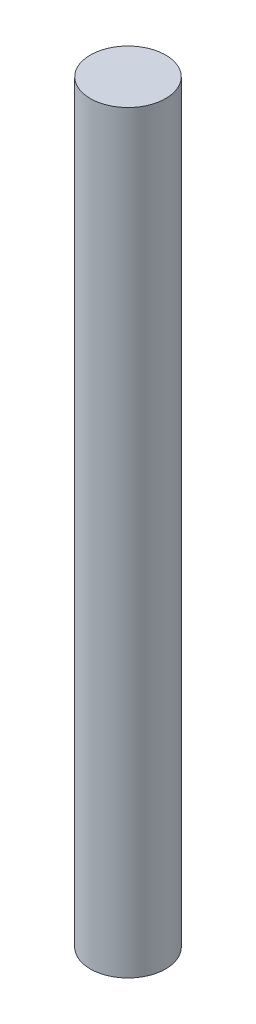
from build123d import *

# Parameters (mm, degrees)
SKETCH1_R           = 4.7625
BOSS_EXTRUDE1_DEPTH = 95.25


with BuildPart() as part:
    # Sketch1 → Boss-Extrude1 (new body)
    with BuildSketch(Plane(origin=(0, 0, 0), x_dir=(1, 0, 0), z_dir=(0, 1, 0))):
        Circle(SKETCH1_R)
    extrude(amount=-BOSS_EXTRUDE1_DEPTH)


solid = part.part
